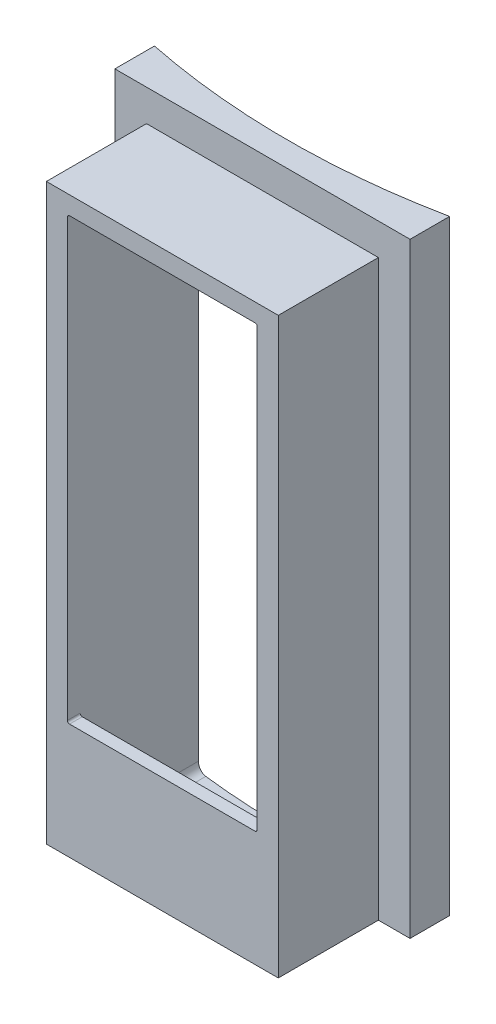
from build123d import *

# Parameters (mm, degrees)
SKETCH1_W           = 88.9
SKETCH1_H           = 182.372
EXTRUDE1_DEPTH      = 230.2002
SKETCH5_W           = 69.85
SKETCH5_H           = 172.847
EXTRUDE4_DEPTH      = 30.15234
EXTRUDE2_DEPTH      = 93.98
EXTRUDE2_DEPTH_BACK = 273.8502
SKETCH4_W           = 57.15
SKETCH4_H           = 132.588
SKETCH6_W           = 57.15
SKETCH6_H           = 32.258
SKETCH6_H_2         = 2.921
EXTRUDE5_DEPTH      = 256.54
FILLET1_R           = 2.54
SKETCH2_R           = 222.758
EXTRUDE3_DEPTH      = 202.86
FILLET2_R           = 0.635


with BuildPart() as part:
    # Sketch1 → Extrude1 (new body)
    with BuildSketch(Plane.XY):
        with Locations((0, -9.017)):
            Rectangle(SKETCH1_W, SKETCH1_H)
    extrude(amount=EXTRUDE1_DEPTH)

    # Sketch5 → Extrude4 (add)
    with BuildSketch(Plane.XY.offset(230.2002)):
        with Locations((0, -13.7795)):
            Rectangle(SKETCH5_W, SKETCH5_H)
    extrude(amount=EXTRUDE4_DEPTH)

    # Sketch4 → Extrude2 (cut, two sides: drawn at the far end of the back side and taken through both)
    with BuildSketch(Plane.XY.offset(230.2002).offset(-EXTRUDE2_DEPTH_BACK)):
        with Locations((0, 0.889)):
            Rectangle(SKETCH4_W, SKETCH4_H)
    extrude(amount=EXTRUDE2_DEPTH + EXTRUDE2_DEPTH_BACK, mode=Mode.SUBTRACT)

    # Sketch6 → Extrude5 (cut)
    with BuildSketch(Plane(origin=(0, 0, 0), x_dir=(-1, 0, 0), z_dir=(0, 0, -1))):
        with Locations((0, -81.534)):
            Rectangle(SKETCH6_W, SKETCH6_H)
        with Locations((0, 68.6435)):
            Rectangle(SKETCH6_W, SKETCH6_H_2)
    extrude(amount=-EXTRUDE5_DEPTH, mode=Mode.SUBTRACT)

    # Fillet1
    fillet1_edges = [part.edges().sort_by_distance(p)[0] for p in [
        (-28.575, -97.663, 128.27),
        (28.575, -97.663, 128.27),
        (-28.575, 70.104, 128.27),
        (28.575, 70.104, 128.27),
    ]]
    fillet(fillet1_edges, radius=FILLET1_R)

    # Sketch2 → Extrude3 (cut)
    with BuildSketch(Plane(origin=(0, 82.169, 0), x_dir=(-1, 0, 0), z_dir=(0, 1, 0))):
        Circle(SKETCH2_R)
    extrude(amount=-EXTRUDE3_DEPTH, mode=Mode.SUBTRACT)

    # Fillet2
    fillet2_edges = [part.edges().sort_by_distance(p)[0] for p in [
        (28.575, 67.183, 258.44627),
        (-28.575, 67.183, 258.44627),
        (-28.575, -65.405, 258.44627),
        (28.575, -65.405, 258.44627),
    ]]
    fillet(fillet2_edges, radius=FILLET2_R)


solid = part.part
